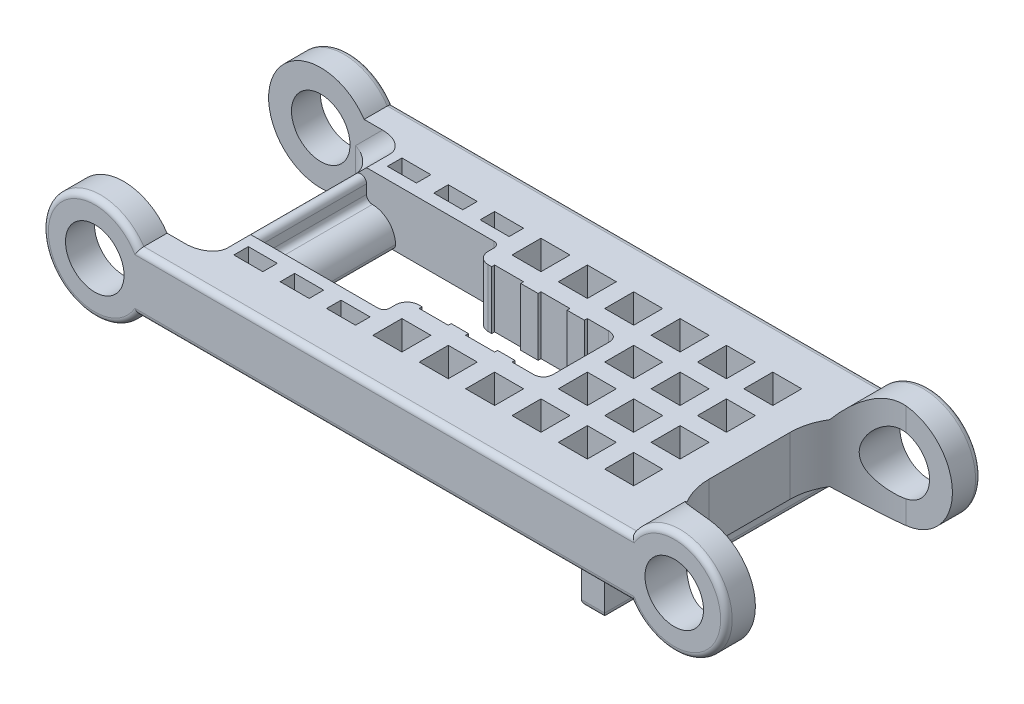
from build123d import *

# Parameters (mm, degrees)
SKETCH1_R               = 5.05
BOSS_EXTRUDE1_DEPTH     = 22
SKETCH4_W               = 18
SKETCH4_H               = 34
CUT_EXTRUDE2_DEPTH      = 56.362442143
SKETCH6_W               = 4
SKETCH6_H               = 3
BOSS_EXTRUDE2_DEPTH     = 16
SKETCH5_W               = 5
SKETCH5_H               = 5
CUT_EXTRUDE3_DEPTH      = 113.343224095
FILLET6_R               = 10
BOSS_EXTRUDE5_REACH     = 118.628
SKETCH13_W              = 4
SKETCH13_H              = 3
CUT_EXTRUDE4_DEPTH      = 34
FILLET17_R              = 3
FILLET5_R               = 1
FILLET18_R              = 1
CUT_EXTRUDE5_DEPTH      = 112.740771548
CUT_EXTRUDE5_DEPTH_BACK = 112.740771548
FILLET19_R              = 2
SKETCH19_W              = 2
SKETCH19_H              = 10
BOSS_EXTRUDE6_DEPTH     = 22
FILLET20_R              = 1
SKETCH20_W              = 5
SKETCH20_H              = 5
BOSS_EXTRUDE7_DEPTH     = 20
FILLET21_R              = 4
FILLET22_R              = 1


# Some blends are built 0.0001 mm under size
with BuildPart() as part:
    # Sketch1 → Boss-Extrude1 (new, symmetric)
    with BuildSketch(Plane.XY):
        with BuildLine():
            Line((50, -5), (50, 5))
            Line((50, 5), (7.483314774, 5))
            ThreePointArc((7.483314774, 5), (-9, 0), (7.483314774, -5))
            Line((7.483314774, -5), (50, -5))
        make_face()
        Circle(SKETCH1_R, mode=Mode.SUBTRACT)
    boss_extrude1 = extrude(amount=BOSS_EXTRUDE1_DEPTH, both=True)

    # Sketch4 → Cut-Extrude2 (cut, symmetric)
    with BuildSketch(Plane(origin=(0, 0, 0), x_dir=(1, 0, 0), z_dir=(0, 1, 0))):
        Rectangle(SKETCH4_W, SKETCH4_H)
    cut_extrude2 = extrude(amount=CUT_EXTRUDE2_DEPTH, both=True, mode=Mode.SUBTRACT)

    # Mirror2: Boss-Extrude1, Cut-Extrude2 across plane
    add(boss_extrude1.mirror(Plane(origin=(50, 0, 22), x_dir=(0, 0, 1), z_dir=(1, 0, 0))))
    add(cut_extrude2.mirror(Plane(origin=(50, 0, 22), x_dir=(0, 0, 1), z_dir=(1, 0, 0))), mode=Mode.SUBTRACT)

    # Sketch6 → Boss-Extrude2 (add)
    with BuildSketch(Plane(origin=(0, 5, 0), x_dir=(1, 0, 0), z_dir=(0, 1, 0))):
        with Locations((85, 19.5)):
            Rectangle(SKETCH6_W, SKETCH6_H)
        with Locations((85, -19.5)):
            Rectangle(SKETCH6_W, SKETCH6_H)
    extrude(amount=-BOSS_EXTRUDE2_DEPTH)

    # Sketch5 → Cut-Extrude3 (cut, through all)
    with BuildSketch(Plane(origin=(0, 5, 0), x_dir=(1, 0, 0), z_dir=(0, 1, 0))):
        with Locations((27, 12)):
            Rectangle(SKETCH5_W, SKETCH5_H)
        with Locations((19, 12)):
            Rectangle(SKETCH5_W, SKETCH5_H)
        with Locations((83, -12)):
            Rectangle(SKETCH5_W, SKETCH5_H)
        with Locations((83, -4)):
            Rectangle(SKETCH5_W, SKETCH5_H)
        with Locations((83, 12)):
            Rectangle(SKETCH5_W, SKETCH5_H)
        with Locations((83, 4)):
            Rectangle(SKETCH5_W, SKETCH5_H)
        with Locations((35, 12)):
            Rectangle(SKETCH5_W, SKETCH5_H)
        with Locations((43, 12)):
            Rectangle(SKETCH5_W, SKETCH5_H)
        with Locations((51, 12)):
            Rectangle(SKETCH5_W, SKETCH5_H)
        with Locations((59, 12)):
            Rectangle(SKETCH5_W, SKETCH5_H)
        with Locations((67, 12)):
            Rectangle(SKETCH5_W, SKETCH5_H)
        with Locations((75, 12)):
            Rectangle(SKETCH5_W, SKETCH5_H)
        with Locations((27, 4)):
            Rectangle(SKETCH5_W, SKETCH5_H)
        with Locations((35, 4)):
            Rectangle(SKETCH5_W, SKETCH5_H)
        with Locations((43, 4)):
            Rectangle(SKETCH5_W, SKETCH5_H)
        with Locations((51, 4)):
            Rectangle(SKETCH5_W, SKETCH5_H)
        with Locations((59, 4)):
            Rectangle(SKETCH5_W, SKETCH5_H)
        with Locations((67, 4)):
            Rectangle(SKETCH5_W, SKETCH5_H)
        with Locations((75, 4)):
            Rectangle(SKETCH5_W, SKETCH5_H)
        with Locations((27, -4)):
            Rectangle(SKETCH5_W, SKETCH5_H)
        with Locations((35, -4)):
            Rectangle(SKETCH5_W, SKETCH5_H)
        with Locations((43, -4)):
            Rectangle(SKETCH5_W, SKETCH5_H)
        with Locations((51, -4)):
            Rectangle(SKETCH5_W, SKETCH5_H)
        with Locations((59, -4)):
            Rectangle(SKETCH5_W, SKETCH5_H)
        with Locations((67, -4)):
            Rectangle(SKETCH5_W, SKETCH5_H)
        with Locations((75, -4)):
            Rectangle(SKETCH5_W, SKETCH5_H)
        with Locations((27, -12)):
            Rectangle(SKETCH5_W, SKETCH5_H)
        with Locations((35, -12)):
            Rectangle(SKETCH5_W, SKETCH5_H)
        with Locations((43, -12)):
            Rectangle(SKETCH5_W, SKETCH5_H)
        with Locations((51, -12)):
            Rectangle(SKETCH5_W, SKETCH5_H)
        with Locations((59, -12)):
            Rectangle(SKETCH5_W, SKETCH5_H)
        with Locations((67, -12)):
            Rectangle(SKETCH5_W, SKETCH5_H)
        with Locations((75, -12)):
            Rectangle(SKETCH5_W, SKETCH5_H)
        with Locations((19, 4)):
            Rectangle(SKETCH5_W, SKETCH5_H)
        with Locations((19, -4)):
            Rectangle(SKETCH5_W, SKETCH5_H)
        with Locations((19, -12)):
            Rectangle(SKETCH5_W, SKETCH5_H)
    extrude(amount=-CUT_EXTRUDE3_DEPTH, mode=Mode.SUBTRACT)

    # Fillet6
    # the kernel refuses this fillet: 10 mm, written as the material it adds along each edge
    with BuildSketch(Plane(origin=(91, 5, -17), x_dir=(1, 0, 0), z_dir=(0, -1, 0))) as fillet6_piece_1_section:
        with BuildLine():
            CenterArc((FILLET6_R, FILLET6_R), FILLET6_R, 180, 90)
            Line((0, FILLET6_R), (0, 0))
            Line((0, 0), (FILLET6_R, 0))
        make_face()
    fillet6_piece_1 = extrude(amount=10, mode=Mode.PRIVATE)
    fillet6_piece_1 = fillet6_piece_1 - Plane(origin=(100, 0, -17), x_dir=(-1, 0, 0), z_dir=(0, 0, -1)) * Cylinder(5.05, 60, mode=Mode.PRIVATE)
    with BuildSketch(Plane(origin=(91, 30, -17), x_dir=(1, 0, 0), z_dir=(0, -1, 0))) as fillet6_piece_2_section:
        with BuildLine():
            CenterArc((FILLET6_R, FILLET6_R), FILLET6_R, 180, 90)
            Line((0, FILLET6_R), (0, 0))
            Line((0, 0), (FILLET6_R, 0))
        make_face()
    fillet6_piece_2 = extrude(amount=60, mode=Mode.PRIVATE)
    fillet6_piece_2 = fillet6_piece_2 & Plane(origin=(100, 0, -17), x_dir=(-0.831479419283098, 0.5555555555555557, 0), z_dir=(0, 0, 1)) * Cylinder(9, 160, mode=Mode.PRIVATE)
    fillet6_piece_2 = fillet6_piece_2 - Plane(origin=(100, 0, -17), x_dir=(-1, 0, 0), z_dir=(0, 0, -1)) * Cylinder(5.05, 160, mode=Mode.PRIVATE)
    with BuildSketch(Plane(origin=(91, 30, 17), x_dir=(0, 0, -1), z_dir=(0, -1, 0))) as fillet6_piece_3_section:
        with BuildLine():
            CenterArc((FILLET6_R, FILLET6_R), FILLET6_R, 180, 90)
            Line((0, FILLET6_R), (0, 0))
            Line((0, 0), (FILLET6_R, 0))
        make_face()
    fillet6_piece_3 = extrude(amount=60, mode=Mode.PRIVATE)
    fillet6_piece_3 = fillet6_piece_3 & Plane(origin=(100, 0, 17), x_dir=(-0.831479419283098, 0.5555555555555557, 0), z_dir=(0, 0, 1)) * Cylinder(9, 160, mode=Mode.PRIVATE)
    fillet6_piece_3 = fillet6_piece_3 - Plane(origin=(100, 0, 17), x_dir=(-1, 0, 0), z_dir=(0, 0, -1)) * Cylinder(5.05, 160, mode=Mode.PRIVATE)
    with BuildSketch(Plane(origin=(91, 5, 17), x_dir=(0, 0, -1), z_dir=(0, -1, 0))) as fillet6_piece_4_section:
        with BuildLine():
            CenterArc((FILLET6_R, FILLET6_R), FILLET6_R, 180, 90)
            Line((0, FILLET6_R), (0, 0))
            Line((0, 0), (FILLET6_R, 0))
        make_face()
    fillet6_piece_4 = extrude(amount=10, mode=Mode.PRIVATE)
    fillet6_piece_4 = fillet6_piece_4 - Plane(origin=(100, 0, 17), x_dir=(-1, 0, 0), z_dir=(0, 0, -1)) * Cylinder(5.05, 60, mode=Mode.PRIVATE)
    add([fillet6_piece_1, fillet6_piece_2, fillet6_piece_3, fillet6_piece_4])

    # Sketch13 → Boss-Extrude5 (add, up to next)
    with BuildSketch(Plane.XY.offset(-18), mode=Mode.PRIVATE) as boss_extrude5_sk1:
        with Locations((85, -9.5)):
            Rectangle(SKETCH13_W, SKETCH13_H)
    boss_extrude5_tool1 = extrude(boss_extrude5_sk1.sketch, amount=BOSS_EXTRUDE5_REACH, mode=Mode.PRIVATE) - part.part
    add(boss_extrude5_tool1.solids().sort_by_distance((85, -9.5, -18))[0])

    # Sketch17 → Cut-Extrude4 (cut)
    with BuildSketch(Plane.XY.offset(-17)):
        Polygon((37.56706793, 37.56706793), (42.516815398, 32.617320461), (-1.414213562, -11.313708499), (-6.363961031, -6.363961031), align=None)
    extrude(amount=CUT_EXTRUDE4_DEPTH, mode=Mode.SUBTRACT)

    # Fillet17
    fillet17_edges = [part.edges().sort_by_distance(p)[0] for p in [
        (11.949747468, 2.050252532, 17),
        (9, -2.949747468, -17),
        (11.949747468, 2.050252532, -17),
        (9, -2.949747468, 17),
    ]]
    fillet(fillet17_edges, radius=FILLET17_R)

    # Fillet5
    fillet5_edges = [part.edges().sort_by_distance(p)[0] for p in [
        (87, -11, 0),
        (83, -11, 0),
        (85, -11, -21),
        (85, -11, 21),
    ]]
    fillet(fillet5_edges, radius=FILLET5_R)

    # Fillet18
    fillet18_edges = [part.edges().sort_by_distance(p)[0] for p in [
        (50, -5, 22),
        (50, 5, 22),
        (109, 0, 22),
        (109, 0, -22),
        (50, -5, -22),
        (-9, 0, -22),
        (50, 5, -22),
        (-9, 0, 22),
    ]]
    fillet(fillet18_edges, radius=FILLET18_R - 0.0001)  # a hair under: the kernel refuses the full size

    # Sketch18 → Cut-Extrude5 (cut, two sides: drawn at the far end of the back side and taken through both)
    with BuildSketch(Plane(origin=(0, 0, 0), x_dir=(1, 0, 0), z_dir=(0, 1, 0)).offset(-CUT_EXTRUDE5_DEPTH_BACK)):
        Polygon((14.899494937, 10), (37.899494937, 10), (37.899494937, 6), (61.899494937, 6), (61.899494937, -6), (37.899494937, -6), (37.899494937, -10), (14.899494937, -10), align=None)
    extrude(amount=CUT_EXTRUDE5_DEPTH + CUT_EXTRUDE5_DEPTH_BACK, mode=Mode.SUBTRACT)

    # Fillet19
    # the kernel refuses this fillet: 2 mm, written as the material it adds along each edge
    with BuildSketch(Plane(origin=(61.5, 5, 6.5), x_dir=(0, 0, -1), z_dir=(0, -1, 0))) as fillet19_piece_1:
        with BuildLine():
            CenterArc((2, -1.322875656), FILLET19_R, 138.590377891, 41.409622109)
            Line((0, -1.322875656), (0, 0))
            Line((0, 0), (0.5, 0))
        make_face()
    extrude(amount=10)
    with BuildSketch(Plane(origin=(61.899494937, 5, 6), x_dir=(0, 0, -1), z_dir=(0, -1, 0))) as fillet19_piece_2:
        with BuildLine():
            CenterArc((1.199326287, -2), FILLET19_R, 90, 36.845775874)
            Line((0, -0.399494937), (0, 0))
            Line((0, 0), (1.199326287, 0))
        make_face()
    extrude(amount=10)
    with BuildSketch(Plane(origin=(61.5, 5, -6.5), x_dir=(-1, 0, 0), z_dir=(0, -1, 0))) as fillet19_piece_3:
        with BuildLine():
            CenterArc((1.322875656, -2), FILLET19_R, 90, 41.409622109)
            Line((0, -0.5), (0, 0))
            Line((0, 0), (1.322875656, 0))
        make_face()
    extrude(amount=10)
    with BuildSketch(Plane(origin=(61.899494937, 5, -6), x_dir=(-1, 0, 0), z_dir=(0, -1, 0))) as fillet19_piece_4:
        with BuildLine():
            CenterArc((2, -1.199326287), FILLET19_R, 143.154224126, 36.845775874)
            Line((0, -1.199326287), (0, 0))
            Line((0, 0), (0.399494937, 0))
        make_face()
    extrude(amount=10)
    # the kernel refuses this fillet: 2 mm, written as the material it takes off along each edge
    with BuildSketch(Plane(origin=(37.899494937, 10, -6), x_dir=(0, 0, -1), z_dir=(0, -1, 0)), Plane(origin=(37.899494937, 10, 6), x_dir=(1, 0, 0), z_dir=(0, -1, 0))) as fillet19_2_piece_1:
        with BuildLine():
            CenterArc((FILLET19_R, FILLET19_R), FILLET19_R, 180, 90)
            Line((0, FILLET19_R), (0, 0))
            Line((0, 0), (FILLET19_R, 0))
        make_face()
    extrude(amount=20, mode=Mode.SUBTRACT)

    # Sketch19 → Boss-Extrude6 (add)
    with BuildSketch(Plane.ZY.offset(-37.5)):
        with Locations((11, 0)):
            Rectangle(SKETCH19_W, SKETCH19_H)
        with Locations((-11, 0)):
            Rectangle(SKETCH19_W, SKETCH19_H)
    extrude(amount=BOSS_EXTRUDE6_DEPTH)

    # Fillet20
    fillet20_edges = [part.edges().sort_by_distance(p)[0] for p in [
        (37.899494937, 0, 10),
        (37.899494937, 0, -10),
    ]]
    fillet(fillet20_edges, radius=FILLET20_R)

    # Sketch20 → Boss-Extrude7 (add)
    with BuildSketch(Plane(origin=(0, 0, 10), x_dir=(-1, 0, 0), z_dir=(0, 0, -1))):
        with Locations((-17.399494937, -2.5)):
            Rectangle(SKETCH20_W, SKETCH20_H)
    extrude(amount=BOSS_EXTRUDE7_DEPTH)

    # Fillet21
    fillet21_edges = [part.edges().sort_by_distance(p)[0] for p in [
        (19.899494937, 0, 0),
    ]]
    fillet(fillet21_edges, radius=FILLET21_R)

    # Fillet22
    fillet22_edges = [part.edges().sort_by_distance(p)[0] for p in [
        (14.899494937, 5, 0),
        (19.899494937, -5, 0),
        (14.899494937, 0, 0),
    ]]
    fillet(fillet22_edges, radius=FILLET22_R - 0.0001)  # a hair under: the kernel refuses the full size


solid = part.part
